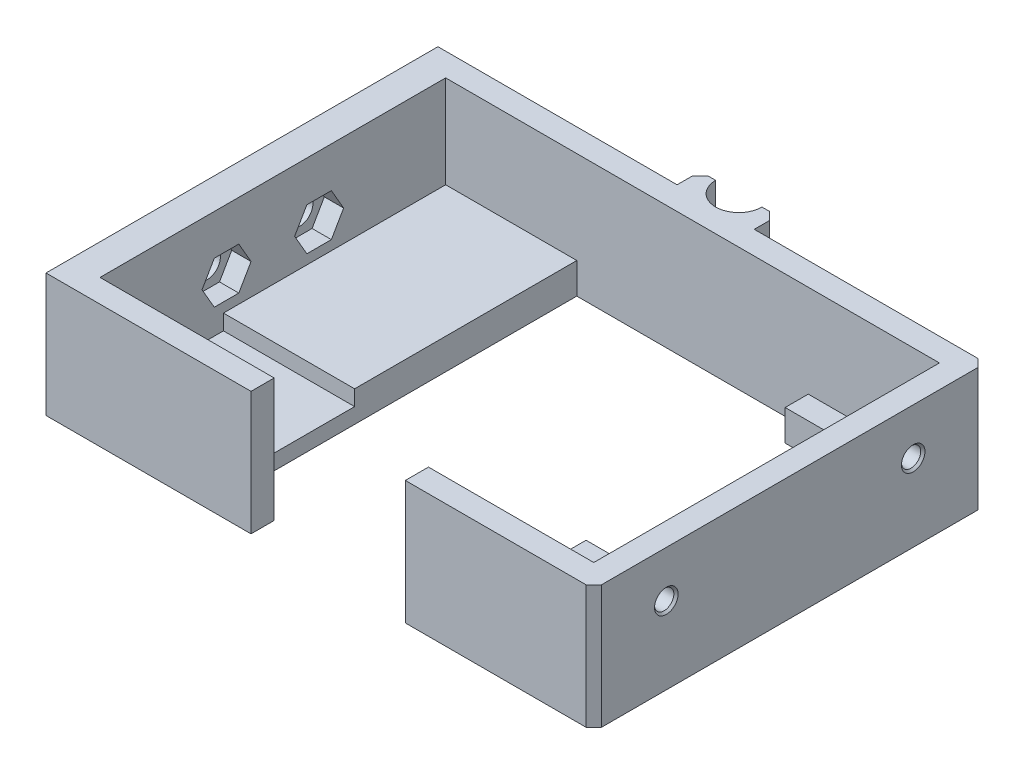
from build123d import *

# Parameters (mm, degrees)
EXTRUDE_1_DEPTH              = 14
EXTRUDE_1_DEPTH_BACK         = 2
SKETCH_1_W                   = 70
SKETCH_1_H                   = 50.8
SKETCH_1_W_2                 = 64
SKETCH_1_H_2                 = 44.8
EXTRUDE_1_2_DEPTH            = 2
EXTRUDE_1_2_DEPTH_BACK       = 2
SKETCH_1_3_W                 = 17
SKETCH_1_3_H                 = 28.8
SKETCH_1_4_W                 = 17
SKETCH_1_4_H                 = 16
EXTRUDE_2_DEPTH              = 2
CUT_EXTRUDE_1_REACH          = 62.876
SKETCH_3_W                   = 20
SKETCH_3_H                   = 16
EXTRUDE_START                = -2
EXTRUDE_5_OUTLINE_W          = 10
EXTRUDE_5_OUTLINE_H          = 3
EXTRUDE_5_DEPTH              = 16
CUT_EXTRUDE_2_REACH          = 49.828
SKETCH_11_R                  = 3
CHAMFER_1_SIZE               = 1
HOLE_WIZARD_M3_1_D           = 2.5
HOLE_WIZARD_M3_1_DEPTH       = 3
HOLE_WIZARD_M3_1_CSINK_D     = 3.05
HOLE_WIZARD_M3_1_CSINK_ANGLE = 90
SKETCH_16_W                  = 50.8
SKETCH_16_H                  = 16
EXTRUDE_6_DEPTH              = 1
CUT_EXTRUDE_3_DEPTH          = 2.5


# Read off the part's stored shape, not the designer's step: M2.5 间隙孔1, 凸台-拉伸5, M3 间隙孔1
with BuildPart() as part:
    # 草图1 → Extrude 1 (new, two sides: drawn at the far end of the back side and taken through both)
    with BuildSketch(Plane(origin=(0, 0, 0), x_dir=(1, 0, 0), z_dir=(0, 1, 0)).offset(-EXTRUDE_1_DEPTH_BACK)):
        Rectangle(SKETCH_1_W, SKETCH_1_H)
        Rectangle(SKETCH_1_W_2, SKETCH_1_H_2, mode=Mode.SUBTRACT)
    extrude(amount=EXTRUDE_1_DEPTH + EXTRUDE_1_DEPTH_BACK)

    # 草图1<3> → Extrude 1 2 (add, two sides: drawn at the far end of the back side and taken through both)
    with BuildSketch(Plane(origin=(0, 0, 0), x_dir=(1, 0, 0), z_dir=(0, 1, 0)).offset(-EXTRUDE_1_2_DEPTH_BACK)):
        Polygon((32, 22.4), (15, 22.4), (15, 19.4), (29.5, 19.4), (29.5, -6.4), (32, -6.4), align=None)
        with Locations((-23.5, 8)):
            Rectangle(SKETCH_1_3_W, SKETCH_1_3_H)
    extrude(amount=EXTRUDE_1_2_DEPTH + EXTRUDE_1_2_DEPTH_BACK)

    # 草图1<4> → 凸台-拉伸2 (add)
    with BuildSketch(Plane(origin=(0, 0, 0), x_dir=(1, 0, 0), z_dir=(0, 1, 0))):
        Polygon((15, -6.4), (15, -22.4), (32, -22.4), (32, -6.4), (29.5, -6.4), align=None)
        with Locations((-23.5, -14.4)):
            Rectangle(SKETCH_1_4_W, SKETCH_1_4_H)
    extrude(amount=-EXTRUDE_2_DEPTH)

    # 草图3 → 切除-拉伸1 (cut, up to next)
    with BuildSketch(Plane(origin=(0, 0, 22.4), x_dir=(-1, 0, 0), z_dir=(0, 0, -1)), mode=Mode.PRIVATE) as cut_extrude_1_sk1:
        with Locations((-0.572922779, 6)):
            Rectangle(SKETCH_3_W, SKETCH_3_H)
    cut_extrude_1_tool1 = extrude(cut_extrude_1_sk1.sketch, amount=-CUT_EXTRUDE_1_REACH, mode=Mode.PRIVATE) & part.part
    add(cut_extrude_1_tool1.solids().sort_by_distance((0.572923, 6, 22.4))[0], mode=Mode.SUBTRACT)

    # M2.5 间隙孔1 outline → M2.5 间隙孔1 (revolve, cut)
    with BuildSketch(Plane(origin=(22, 0, 17.05), x_dir=(1, 0, 0), z_dir=(0, 0, 1))):
        Polygon((0, -2), (1.45, -2), (1.45, -0.025), (1.475, 0), (0, 0), align=None)
    revolve(axis=Axis((22, 0, 17.05), (0, 1, 0)), mode=Mode.SUBTRACT)

    # Hole Wizard M2.5 _1 2 outline → Hole Wizard M2.5 _1 2 (revolve, cut)
    with BuildSketch(Plane(origin=(-22, 0, 17.05), x_dir=(1, 0, 0), z_dir=(0, 0, 1))):
        Polygon((0, -2), (1.45, -2), (1.45, -0.025), (1.475, 0), (0, 0), align=None)
    revolve(axis=Axis((-22, 0, 17.05), (0, 1, 0)), mode=Mode.SUBTRACT)

    # 凸台-拉伸5 outline → 凸台-拉伸5 (add)
    with BuildSketch(Plane(origin=(0, 0, 0), x_dir=(1, 0, 0), z_dir=(0, 1, 0)).offset(EXTRUDE_START)):
        with Locations((0, 26.9)):
            Rectangle(EXTRUDE_5_OUTLINE_W, EXTRUDE_5_OUTLINE_H)
    extrude(amount=EXTRUDE_5_DEPTH)

    # 草图11 → 切除-拉伸2 (cut, up to next)
    with BuildSketch(Plane(origin=(0, 14, 0), x_dir=(1, 0, 0), z_dir=(0, 1, 0)), mode=Mode.PRIVATE) as cut_extrude_2_sk1:
        with Locations((0, 28.4)):
            Circle(SKETCH_11_R)
    cut_extrude_2_tool1 = extrude(cut_extrude_2_sk1.sketch, amount=-CUT_EXTRUDE_2_REACH, mode=Mode.PRIVATE) & part.part
    add(cut_extrude_2_tool1.solids().sort_by_distance((0, 14, -28.4))[0], mode=Mode.SUBTRACT)

    # 倒角1
    chamfer_1_edges = [part.edges().sort_by_distance(p)[0] for p in [
        (5, 6, -28.4),
        (-5, 6, -28.4),
        (35, 6, -25.4),
        (35, 6, 25.4),
    ]]
    chamfer(chamfer_1_edges, length=CHAMFER_1_SIZE)

    # Hole Wizard M3 _1
    with Locations(Plane(origin=(35, 0, 0), x_dir=(0, 0, -1), z_dir=(1, 0, 0))):
        with Locations((-16, 8), (16, 8)):
            CounterSinkHole(HOLE_WIZARD_M3_1_D / 2, HOLE_WIZARD_M3_1_CSINK_D / 2, depth=HOLE_WIZARD_M3_1_DEPTH, counter_sink_angle=HOLE_WIZARD_M3_1_CSINK_ANGLE)

    # 草图16 → 凸台-拉伸6 (add)
    with BuildSketch(Plane.ZY.offset(35)):
        with Locations((0, 6)):
            Rectangle(SKETCH_16_W, SKETCH_16_H)
    extrude(amount=EXTRUDE_6_DEPTH)

    # Hole Wizard M3 _1 2 outline → Hole Wizard M3 _1 2 (revolve, cut)
    with BuildSketch(Plane(origin=(0, 6, 6), x_dir=(0, 1, 0), z_dir=(0, 0, -1))):
        Polygon((1.7, -35.975), (1.7, -32), (0, -32), (0, -36), (1.725, -36), align=None)
    revolve(axis=Axis((0, 6, 6), (1, 0, 0)), mode=Mode.SUBTRACT)

    # Hole Wizard M3 _1 2 2 outline → Hole Wizard M3 _1 2 2 (revolve, cut)
    with BuildSketch(Plane(origin=(0, 6, -6), x_dir=(0, 1, 0), z_dir=(0, 0, -1))):
        Polygon((1.7, -35.975), (1.7, -32), (0, -32), (0, -36), (1.725, -36), align=None)
    revolve(axis=Axis((0, 6, -6), (1, 0, 0)), mode=Mode.SUBTRACT)

    # 草图23 → 切除-拉伸3 (cut)
    with BuildSketch(Plane(origin=(-32, 0, 0), x_dir=(0, 0, -1), z_dir=(1, 0, 0))):
        Polygon((-9.175426481, 6), (-7.58771324, 3.25), (-4.41228676, 3.25), (-2.824573519, 6), (-4.41228676, 8.75), (-7.58771324, 8.75), align=None)
        Polygon((2.824573519, 6), (4.41228676, 3.25), (7.58771324, 3.25), (9.175426481, 6), (7.58771324, 8.75), (4.41228676, 8.75), align=None)
    extrude(amount=-CUT_EXTRUDE_3_DEPTH, mode=Mode.SUBTRACT)


solid = part.part
